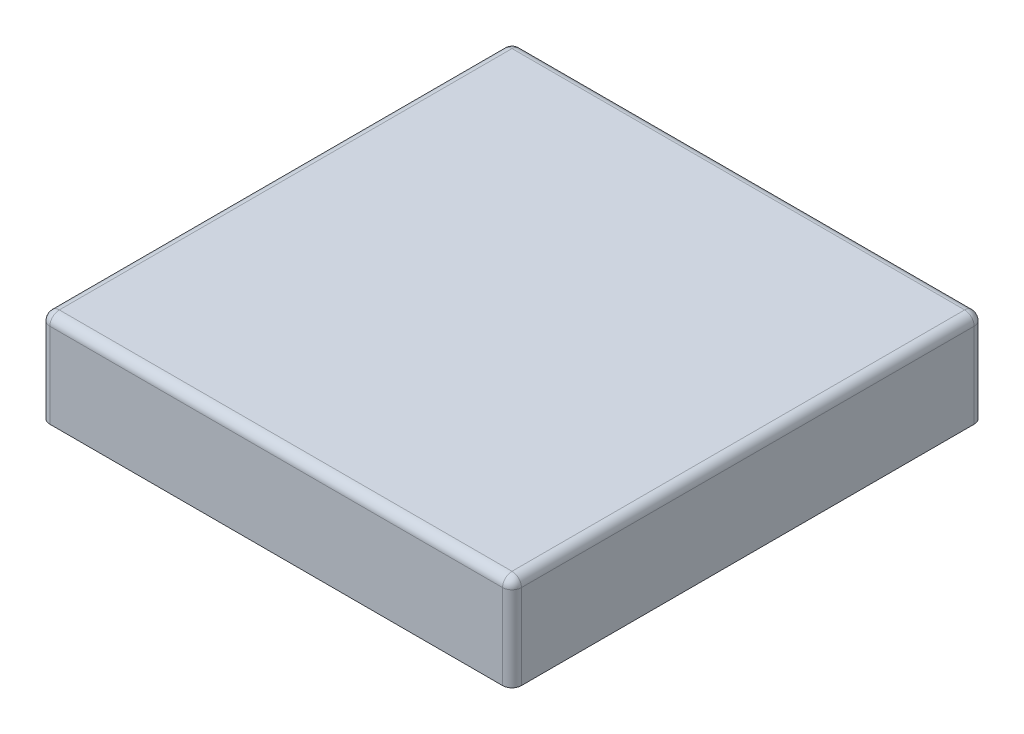
from build123d import *

# Parameters (mm, degrees)
SKETCH1_W           = 5
SKETCH1_H           = 5
BOSS_EXTRUDE1_DEPTH = 1
FILLET1_R           = 0.1
FILLET2_R           = 0.1


with BuildPart() as part:
    # Sketch1 → Boss-Extrude1 (new body)
    with BuildSketch(Plane(origin=(0, 0, 0), x_dir=(1, 0, 0), z_dir=(0, 1, 0))):
        with Locations((2.5, 2.5)):
            Rectangle(SKETCH1_W, SKETCH1_H)
    extrude(amount=BOSS_EXTRUDE1_DEPTH)

    # Fillet1
    fillet1_edges = [part.edges().sort_by_distance(p)[0] for p in [
        (5, 1, -2.5),
        (2.5, 1, -5),
        (0, 1, -2.5),
        (2.5, 1, 0),
    ]]
    fillet(fillet1_edges, radius=FILLET1_R)

    # Fillet2
    # the kernel refuses this fillet: 0.1 mm, written as the material it takes off along each edge
    with BuildSketch(Plane(origin=(4.9, 0.9, -4.9), x_dir=(0, 0, -1), z_dir=(1, 0, 0))) as fillet2_piece_1_section:
        Polygon((0, 0), (FILLET2_R, 0), (FILLET2_R, FILLET2_R), (0, FILLET2_R), align=None)
    fillet2_piece_1 = extrude(amount=FILLET2_R, mode=Mode.PRIVATE)
    fillet2_piece_1 = fillet2_piece_1 - Plane(origin=(4.9, 0.9, -4.9), x_dir=(0, -0.7071067811865475, 0.7071067811865475), z_dir=(1, 0, 0)) * Sphere(FILLET2_R, mode=Mode.PRIVATE)
    add(fillet2_piece_1, mode=Mode.SUBTRACT)
    with BuildSketch(Plane(origin=(4.9, 0.9, -0.1), x_dir=(1, 0, 0), z_dir=(0, 0, 1))) as fillet2_piece_2_section:
        Polygon((0, 0), (FILLET2_R, 0), (FILLET2_R, FILLET2_R), (0, FILLET2_R), align=None)
    fillet2_piece_2 = extrude(amount=FILLET2_R, mode=Mode.PRIVATE)
    fillet2_piece_2 = fillet2_piece_2 - Plane(origin=(4.9, 0.9, -0.1), x_dir=(-0.7071067811865475, -0.7071067811865475, 0), z_dir=(0, 0, 1)) * Sphere(FILLET2_R, mode=Mode.PRIVATE)
    add(fillet2_piece_2, mode=Mode.SUBTRACT)
    with BuildSketch(Plane(origin=(0.1, 0.9, -4.9), x_dir=(0, 0, -1), z_dir=(-1, 0, 0))) as fillet2_piece_3_section:
        Polygon((0, 0), (FILLET2_R, 0), (FILLET2_R, -FILLET2_R), (0, -FILLET2_R), align=None)
    fillet2_piece_3 = extrude(amount=FILLET2_R, mode=Mode.PRIVATE)
    fillet2_piece_3 = fillet2_piece_3 - Plane(origin=(0.1, 0.9, -4.9), x_dir=(0, -0.7071067811865475, 0.7071067811865475), z_dir=(-1, 0, 0)) * Sphere(FILLET2_R, mode=Mode.PRIVATE)
    add(fillet2_piece_3, mode=Mode.SUBTRACT)
    with BuildSketch(Plane(origin=(0.1, 0.9, -0.1), x_dir=(-1, 0, 0), z_dir=(0, 0, 1))) as fillet2_piece_4_section:
        Polygon((0, 0), (FILLET2_R, 0), (FILLET2_R, -FILLET2_R), (0, -FILLET2_R), align=None)
    fillet2_piece_4 = extrude(amount=FILLET2_R, mode=Mode.PRIVATE)
    fillet2_piece_4 = fillet2_piece_4 - Plane(origin=(0.1, 0.9, -0.1), x_dir=(0.7071067811865475, -0.7071067811865475, 0), z_dir=(0, 0, 1)) * Sphere(FILLET2_R, mode=Mode.PRIVATE)
    add(fillet2_piece_4, mode=Mode.SUBTRACT)
    with BuildSketch(Plane(origin=(0, -0.25, 0), x_dir=(1, 0, 0), z_dir=(0, 1, 0)), Plane(origin=(0, -0.25, -5), x_dir=(0, 0, 1), z_dir=(0, 1, 0))) as fillet2_piece_5:
        with BuildLine():
            CenterArc((FILLET2_R, FILLET2_R), FILLET2_R, 180, 90)
            Line((0, FILLET2_R), (0, 0))
            Line((0, 0), (FILLET2_R, 0))
        make_face()
    extrude(amount=1.15, mode=Mode.SUBTRACT)
    with BuildSketch(Plane(origin=(5, -0.25, 0), x_dir=(-1, 0, 0), z_dir=(0, 1, 0)), Plane(origin=(5, -0.25, -5), x_dir=(0, 0, 1), z_dir=(0, 1, 0))) as fillet2_piece_6:
        with BuildLine():
            CenterArc((FILLET2_R, -FILLET2_R), FILLET2_R, 90, 90)
            Line((0, -FILLET2_R), (0, 0))
            Line((0, 0), (FILLET2_R, 0))
        make_face()
    extrude(amount=1.15, mode=Mode.SUBTRACT)


solid = part.part
